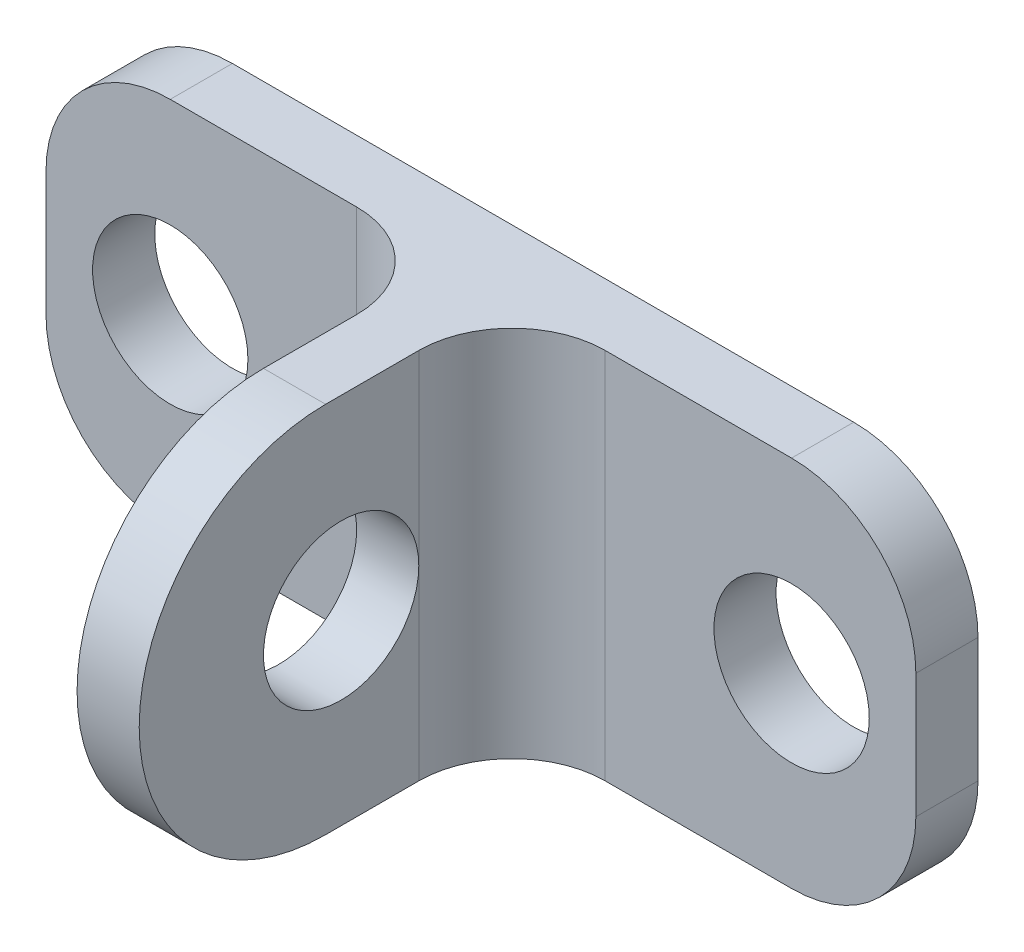
from build123d import *

# Parameters (mm, degrees)
CROQUIS1_R              = 1.25
SALIENTE_EXTRUIR1_DEPTH = 1
CROQUIS2_W              = 1
CROQUIS2_H              = 6
SALIENTE_EXTRUIR2_DEPTH = 6
REDONDEO1_RADIUS        = 3
REDONDEO1_LENGTH        = 1
CORTAR_EXTRUIR1_REACH   = 12.689
CROQUIS3_R              = 1.25
REDONDEO2_R             = 1.5


with BuildPart() as part:
    # Croquis1 → Saliente-Extruir1 (new body)
    with BuildSketch(Plane.XY):
        with BuildLine():
            Line((-5, -3), (5, -3))
            ThreePointArc((5, -3), (6.414213562, -2.414213562), (7, -1))
            Line((7, -1), (7, 1))
            ThreePointArc((7, 1), (6.414213562, 2.414213562), (5, 3))
            Line((5, 3), (-5, 3))
            ThreePointArc((-5, 3), (-6.414213562, 2.414213562), (-7, 1))
            Line((-7, 1), (-7, -1))
            ThreePointArc((-7, -1), (-6.414213562, -2.414213562), (-5, -3))
        make_face()
        with Locations((-5, 0)):
            Circle(CROQUIS1_R, mode=Mode.SUBTRACT)
        with Locations((5, 0)):
            Circle(CROQUIS1_R, mode=Mode.SUBTRACT)
    extrude(amount=SALIENTE_EXTRUIR1_DEPTH)

    # Croquis2 → Saliente-Extruir2 (add)
    with BuildSketch(Plane.XY.offset(1)):
        Rectangle(CROQUIS2_W, CROQUIS2_H)
    extrude(amount=SALIENTE_EXTRUIR2_DEPTH)

    # Redondeo1: full round fillet: the end face becomes a half cylinder, R = half its width
    redondeo1_face = Plane((0, 0, 7), x_dir=(-1, 0, 0), z_dir=(0, 0, 1))  # on the end face: x along it, z out of the body
    redondeo1_slab = redondeo1_face.offset(-REDONDEO1_RADIUS / 2) * Box(REDONDEO1_LENGTH, 2 * REDONDEO1_RADIUS, REDONDEO1_RADIUS, mode=Mode.PRIVATE)  # the body's end, R deep
    redondeo1_round = Plane((0, 0, 4), x_dir=(0, 0, 1), z_dir=(-1, 0, 0)) * Cylinder(REDONDEO1_RADIUS, REDONDEO1_LENGTH, mode=Mode.PRIVATE)  # its axis R under the face
    add(redondeo1_slab - redondeo1_round, mode=Mode.SUBTRACT)

    # Croquis3 → Cortar-Extruir1 (cut, up to next)
    with BuildSketch(Plane.ZY.offset(0.5), mode=Mode.PRIVATE) as cortar_extruir1_sk1:
        with Locations((3.75, 0)):
            Circle(CROQUIS3_R)
    cortar_extruir1_tool1 = extrude(cortar_extruir1_sk1.sketch, amount=-CORTAR_EXTRUIR1_REACH, mode=Mode.PRIVATE) & part.part
    add(cortar_extruir1_tool1.solids().sort_by_distance((-0.5, 0, 3.75))[0], mode=Mode.SUBTRACT)

    # Redondeo2
    redondeo2_edges = [part.edges().sort_by_distance(p)[0] for p in [
        (0.5, 0, 1),
        (-0.5, 0, 1),
    ]]
    fillet(redondeo2_edges, radius=REDONDEO2_R - 0.0001)  # a hair under: the kernel refuses the full size


solid = part.part
